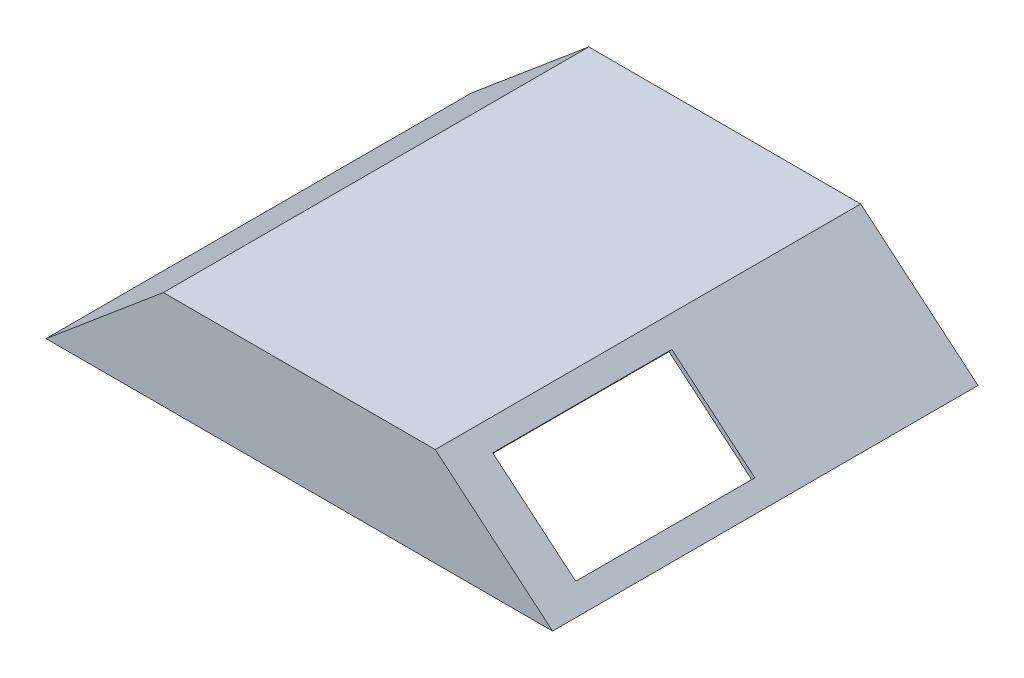
from build123d import *

# Parameters (mm, degrees)
SALIENTE_EXTRUIR1_DEPTH = 94
CORTAR_EXTRUIR2_REACH   = 128.507
CROQUIS3_W              = 40
CROQUIS3_H              = 24.204400932
SALIENTE_EXTRUIR2_DEPTH = 1


with BuildPart() as part:
    # Croquis1 → Saliente-Extruir1 (new body)
    with BuildSketch(Plane.XY):
        Polygon((-55, 0), (-56.554745497, 0), (-30.364269306, 22), (30.364269306, 22), (56.554745497, 0), (55, 0), (30, 21), (-30, 21), align=None)
    extrude(amount=SALIENTE_EXTRUIR1_DEPTH)

    # Croquis3 → Cortar-Extruir2 (cut, up to next)
    with BuildSketch(Plane(origin=(23.396475388, 27.852946891, 0), x_dir=(0, 0, -1), z_dir=(0.6431920864232733, 0.7657048647896112, 0)), mode=Mode.PRIVATE) as cortar_extruir2_sk1:
        with Locations((-66, -26.202043288)):
            Rectangle(CROQUIS3_W, CROQUIS3_H)
    cortar_extruir2_tool1 = extrude(cortar_extruir2_sk1.sketch, amount=-CORTAR_EXTRUIR2_REACH, mode=Mode.PRIVATE) & part.part
    add(cortar_extruir2_tool1.solids().sort_by_distance((43.459507, 11, 66))[0], mode=Mode.SUBTRACT)

    # Croquis4 → Saliente-Extruir2 (add)
    with BuildSketch(Plane.XY.offset(94)):
        Polygon((-56.554745497, 0), (56.554745497, 0), (30.364269306, 22), (-30.364269306, 22), align=None)
    extrude(amount=SALIENTE_EXTRUIR2_DEPTH)


solid = part.part
